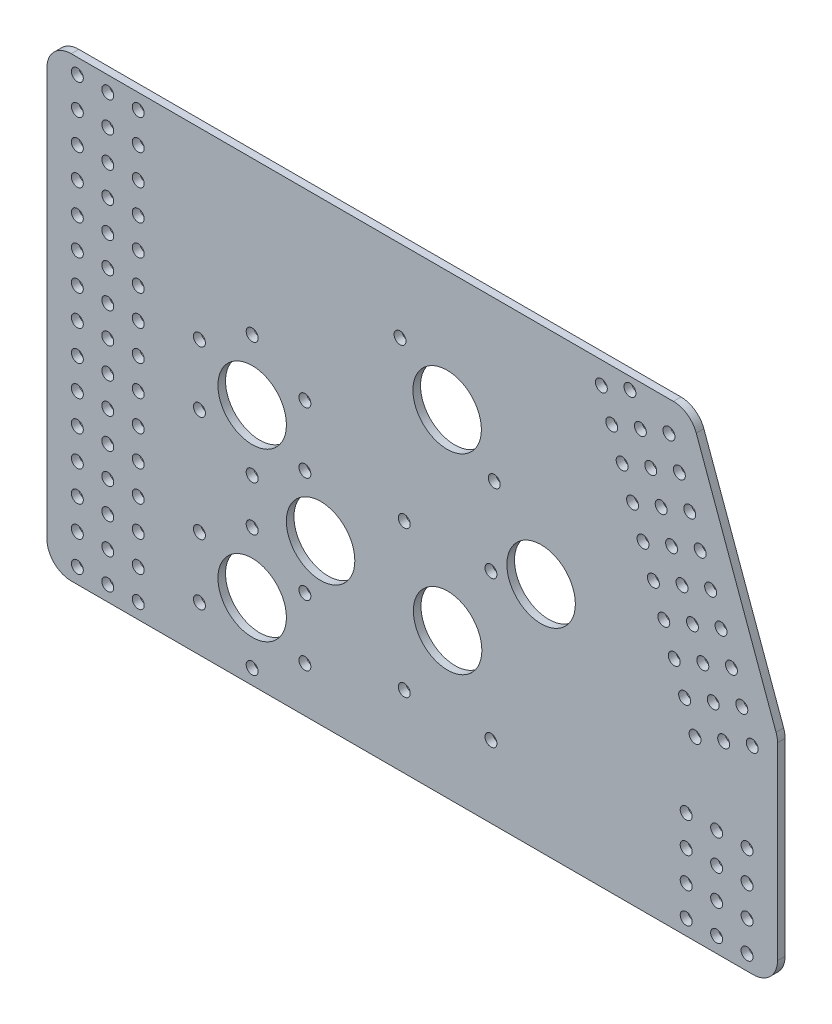
from build123d import *

# Parameters (mm, degrees)
SKETCH6_R           = 2.4892
SKETCH6_R_2         = 14.2875
BOSS_EXTRUDE1_DEPTH = 3.175
FILLET1_R           = 10.16


with BuildPart() as part:
    # Sketch6 → Boss-Extrude1 (new body)
    with BuildSketch(Plane.XY):
        Polygon((-62.034734806, 275.060295422), (206.435304788, 275.060295422), (242.765265194, 175.244549557), (242.765265194, 84.560295422), (-62.034734806, 84.560295422), align=None)
        with Locations((123.22406409, 114.608841068)):
            Circle(SKETCH6_R, mode=Mode.SUBTRACT)
        with Locations((87.05446409, 114.608841068)):
            Circle(SKETCH6_R, mode=Mode.SUBTRACT)
        with Locations((-49.334734806, 268.710295422)):
            Circle(SKETCH6_R, mode=Mode.SUBTRACT)
        with Locations((-49.334734806, 90.910295422)):
            Circle(SKETCH6_R, mode=Mode.SUBTRACT)
        with Locations((-36.634734806, 268.710295422)):
            Circle(SKETCH6_R, mode=Mode.SUBTRACT)
        with Locations((-23.934734806, 268.710295422)):
            Circle(SKETCH6_R, mode=Mode.SUBTRACT)
        with Locations((-36.634734806, 256.010295422)):
            Circle(SKETCH6_R, mode=Mode.SUBTRACT)
        with Locations((-23.934734806, 256.010295422)):
            Circle(SKETCH6_R, mode=Mode.SUBTRACT)
        with Locations((-36.634734806, 243.310295422)):
            Circle(SKETCH6_R, mode=Mode.SUBTRACT)
        with Locations((-23.934734806, 243.310295422)):
            Circle(SKETCH6_R, mode=Mode.SUBTRACT)
        with Locations((-36.634734806, 230.610295422)):
            Circle(SKETCH6_R, mode=Mode.SUBTRACT)
        with Locations((-23.934734806, 230.610295422)):
            Circle(SKETCH6_R, mode=Mode.SUBTRACT)
        with Locations((-36.634734806, 217.910295422)):
            Circle(SKETCH6_R, mode=Mode.SUBTRACT)
        with Locations((-23.934734806, 217.910295422)):
            Circle(SKETCH6_R, mode=Mode.SUBTRACT)
        with Locations((-36.634734806, 205.210295422)):
            Circle(SKETCH6_R, mode=Mode.SUBTRACT)
        with Locations((-23.934734806, 205.210295422)):
            Circle(SKETCH6_R, mode=Mode.SUBTRACT)
        with Locations((-36.634734806, 192.510295422)):
            Circle(SKETCH6_R, mode=Mode.SUBTRACT)
        with Locations((-23.934734806, 192.510295422)):
            Circle(SKETCH6_R, mode=Mode.SUBTRACT)
        with Locations((-36.634734806, 179.810295422)):
            Circle(SKETCH6_R, mode=Mode.SUBTRACT)
        with Locations((-23.934734806, 179.810295422)):
            Circle(SKETCH6_R, mode=Mode.SUBTRACT)
        with Locations((-36.634734806, 167.110295422)):
            Circle(SKETCH6_R, mode=Mode.SUBTRACT)
        with Locations((-23.934734806, 167.110295422)):
            Circle(SKETCH6_R, mode=Mode.SUBTRACT)
        with Locations((-36.634734806, 154.410295422)):
            Circle(SKETCH6_R, mode=Mode.SUBTRACT)
        with Locations((-23.934734806, 154.410295422)):
            Circle(SKETCH6_R, mode=Mode.SUBTRACT)
        with Locations((-36.634734806, 141.710295422)):
            Circle(SKETCH6_R, mode=Mode.SUBTRACT)
        with Locations((-23.934734806, 141.710295422)):
            Circle(SKETCH6_R, mode=Mode.SUBTRACT)
        with Locations((-36.634734806, 129.010295422)):
            Circle(SKETCH6_R, mode=Mode.SUBTRACT)
        with Locations((-23.934734806, 129.010295422)):
            Circle(SKETCH6_R, mode=Mode.SUBTRACT)
        with Locations((-36.634734806, 116.310295422)):
            Circle(SKETCH6_R, mode=Mode.SUBTRACT)
        with Locations((-23.934734806, 116.310295422)):
            Circle(SKETCH6_R, mode=Mode.SUBTRACT)
        with Locations((-36.634734806, 103.610295422)):
            Circle(SKETCH6_R, mode=Mode.SUBTRACT)
        with Locations((-23.934734806, 103.610295422)):
            Circle(SKETCH6_R, mode=Mode.SUBTRACT)
        with Locations((-36.634734806, 90.910295422)):
            Circle(SKETCH6_R, mode=Mode.SUBTRACT)
        with Locations((-23.934734806, 90.910295422)):
            Circle(SKETCH6_R, mode=Mode.SUBTRACT)
        with Locations((-49.334734806, 256.010295422)):
            Circle(SKETCH6_R, mode=Mode.SUBTRACT)
        with Locations((-49.334734806, 243.310295422)):
            Circle(SKETCH6_R, mode=Mode.SUBTRACT)
        with Locations((-49.334734806, 230.610295422)):
            Circle(SKETCH6_R, mode=Mode.SUBTRACT)
        with Locations((-49.334734806, 217.910295422)):
            Circle(SKETCH6_R, mode=Mode.SUBTRACT)
        with Locations((-49.334734806, 205.210295422)):
            Circle(SKETCH6_R, mode=Mode.SUBTRACT)
        with Locations((-49.334734806, 192.510295422)):
            Circle(SKETCH6_R, mode=Mode.SUBTRACT)
        with Locations((-49.334734806, 179.810295422)):
            Circle(SKETCH6_R, mode=Mode.SUBTRACT)
        with Locations((-49.334734806, 167.110295422)):
            Circle(SKETCH6_R, mode=Mode.SUBTRACT)
        with Locations((-49.334734806, 154.410295422)):
            Circle(SKETCH6_R, mode=Mode.SUBTRACT)
        with Locations((-49.334734806, 141.710295422)):
            Circle(SKETCH6_R, mode=Mode.SUBTRACT)
        with Locations((-49.334734806, 129.010295422)):
            Circle(SKETCH6_R, mode=Mode.SUBTRACT)
        with Locations((-49.334734806, 116.310295422)):
            Circle(SKETCH6_R, mode=Mode.SUBTRACT)
        with Locations((-49.334734806, 103.610295422)):
            Circle(SKETCH6_R, mode=Mode.SUBTRACT)
        with Locations((169.26865969, 265.77786594)):
            Circle(SKETCH6_R, mode=Mode.SUBTRACT)
        with Locations((181.202755974, 270.121521761)):
            Circle(SKETCH6_R, mode=Mode.SUBTRACT)
        with Locations((197.480508078, 262.531081297)):
            Circle(SKETCH6_R, mode=Mode.SUBTRACT)
        with Locations((173.61231551, 253.843769656)):
            Circle(SKETCH6_R, mode=Mode.SUBTRACT)
        with Locations((185.546411794, 258.187425477)):
            Circle(SKETCH6_R, mode=Mode.SUBTRACT)
        with Locations((201.824163899, 250.596985013)):
            Circle(SKETCH6_R, mode=Mode.SUBTRACT)
        with Locations((177.955971331, 241.909673372)):
            Circle(SKETCH6_R, mode=Mode.SUBTRACT)
        with Locations((189.890067615, 246.253329193)):
            Circle(SKETCH6_R, mode=Mode.SUBTRACT)
        with Locations((206.167819719, 238.662888729)):
            Circle(SKETCH6_R, mode=Mode.SUBTRACT)
        with Locations((182.299627151, 229.975577088)):
            Circle(SKETCH6_R, mode=Mode.SUBTRACT)
        with Locations((194.233723435, 234.319232909)):
            Circle(SKETCH6_R, mode=Mode.SUBTRACT)
        with Locations((210.511475539, 226.728792445)):
            Circle(SKETCH6_R, mode=Mode.SUBTRACT)
        with Locations((186.643282971, 218.041480804)):
            Circle(SKETCH6_R, mode=Mode.SUBTRACT)
        with Locations((198.577379255, 222.385136625)):
            Circle(SKETCH6_R, mode=Mode.SUBTRACT)
        with Locations((214.855131359, 214.794696161)):
            Circle(SKETCH6_R, mode=Mode.SUBTRACT)
        with Locations((190.986938791, 206.10738452)):
            Circle(SKETCH6_R, mode=Mode.SUBTRACT)
        with Locations((202.921035075, 210.451040341)):
            Circle(SKETCH6_R, mode=Mode.SUBTRACT)
        with Locations((219.19878718, 202.860599877)):
            Circle(SKETCH6_R, mode=Mode.SUBTRACT)
        with Locations((195.330594612, 194.173288236)):
            Circle(SKETCH6_R, mode=Mode.SUBTRACT)
        with Locations((207.264690896, 198.516944057)):
            Circle(SKETCH6_R, mode=Mode.SUBTRACT)
        with Locations((223.542443, 190.926503593)):
            Circle(SKETCH6_R, mode=Mode.SUBTRACT)
        with Locations((199.674250432, 182.239191952)):
            Circle(SKETCH6_R, mode=Mode.SUBTRACT)
        with Locations((211.608346716, 186.582847773)):
            Circle(SKETCH6_R, mode=Mode.SUBTRACT)
        with Locations((227.88609882, 178.992407309)):
            Circle(SKETCH6_R, mode=Mode.SUBTRACT)
        with Locations((204.017906252, 170.305095668)):
            Circle(SKETCH6_R, mode=Mode.SUBTRACT)
        with Locations((215.952002536, 174.648751489)):
            Circle(SKETCH6_R, mode=Mode.SUBTRACT)
        with Locations((232.22975464, 167.058311025)):
            Circle(SKETCH6_R, mode=Mode.SUBTRACT)
        with Locations((208.361562072, 158.370999384)):
            Circle(SKETCH6_R, mode=Mode.SUBTRACT)
        with Locations((220.295658356, 162.714655205)):
            Circle(SKETCH6_R, mode=Mode.SUBTRACT)
        with Locations((204.665265194, 129.010295422)):
            Circle(SKETCH6_R, mode=Mode.SUBTRACT)
        with Locations((217.365265194, 129.010295422)):
            Circle(SKETCH6_R, mode=Mode.SUBTRACT)
        with Locations((230.065265194, 129.010295422)):
            Circle(SKETCH6_R, mode=Mode.SUBTRACT)
        with Locations((204.665265194, 116.310295422)):
            Circle(SKETCH6_R, mode=Mode.SUBTRACT)
        with Locations((217.365265194, 116.310295422)):
            Circle(SKETCH6_R, mode=Mode.SUBTRACT)
        with Locations((230.065265194, 116.310295422)):
            Circle(SKETCH6_R, mode=Mode.SUBTRACT)
        with Locations((204.665265194, 103.610295422)):
            Circle(SKETCH6_R, mode=Mode.SUBTRACT)
        with Locations((217.365265194, 103.610295422)):
            Circle(SKETCH6_R, mode=Mode.SUBTRACT)
        with Locations((230.065265194, 103.610295422)):
            Circle(SKETCH6_R, mode=Mode.SUBTRACT)
        with Locations((204.665265194, 90.910295422)):
            Circle(SKETCH6_R, mode=Mode.SUBTRACT)
        with Locations((217.365265194, 90.910295422)):
            Circle(SKETCH6_R, mode=Mode.SUBTRACT)
        with Locations((230.065265194, 90.910295422)):
            Circle(SKETCH6_R, mode=Mode.SUBTRACT)
        with Locations((23.601611853, 185.85256672)):
            Circle(SKETCH6_R_2, mode=Mode.SUBTRACT)
        with Locations((52.142163008, 151.05639055)):
            Circle(SKETCH6_R_2, mode=Mode.SUBTRACT)
        with Locations((23.601611853, 116.25656672)):
            Circle(SKETCH6_R_2, mode=Mode.SUBTRACT)
        with Locations((105.13926409, 145.139641068)):
            Circle(SKETCH6_R_2, mode=Mode.SUBTRACT)
        with Locations((104.944740556, 224.82726801)):
            Circle(SKETCH6_R_2, mode=Mode.SUBTRACT)
        with Locations((144.142354475, 181.392565924)):
            Circle(SKETCH6_R_2, mode=Mode.SUBTRACT)
        with Locations((85.284021432, 241.01081705)):
            Circle(SKETCH6_R, mode=Mode.SUBTRACT)
        with Locations((23.601611853, 141.65656672)):
            Circle(SKETCH6_R, mode=Mode.SUBTRACT)
        with Locations((45.598657109, 128.95656672)):
            Circle(SKETCH6_R, mode=Mode.SUBTRACT)
        with Locations((45.598657109, 103.55656672)):
            Circle(SKETCH6_R, mode=Mode.SUBTRACT)
        with Locations((23.601611853, 90.85656672)):
            Circle(SKETCH6_R, mode=Mode.SUBTRACT)
        with Locations((1.604566597, 103.55656672)):
            Circle(SKETCH6_R, mode=Mode.SUBTRACT)
        with Locations((1.604566597, 128.95656672)):
            Circle(SKETCH6_R, mode=Mode.SUBTRACT)
        with Locations((23.601611853, 211.25256672)):
            Circle(SKETCH6_R, mode=Mode.SUBTRACT)
        with Locations((45.598657109, 198.55256672)):
            Circle(SKETCH6_R, mode=Mode.SUBTRACT)
        with Locations((45.598657109, 173.15256672)):
            Circle(SKETCH6_R, mode=Mode.SUBTRACT)
        with Locations((23.601611853, 160.45256672)):
            Circle(SKETCH6_R, mode=Mode.SUBTRACT)
        with Locations((1.604566597, 173.15256672)):
            Circle(SKETCH6_R, mode=Mode.SUBTRACT)
        with Locations((1.604566597, 198.55256672)):
            Circle(SKETCH6_R, mode=Mode.SUBTRACT)
        with Locations((123.22406409, 175.670441068)):
            Circle(SKETCH6_R, mode=Mode.SUBTRACT)
        with Locations((87.05446409, 175.670441068)):
            Circle(SKETCH6_R, mode=Mode.SUBTRACT)
        with Locations((124.606520638, 208.84902209)):
            Circle(SKETCH6_R, mode=Mode.SUBTRACT)
    extrude(amount=BOSS_EXTRUDE1_DEPTH)

    # Fillet1
    fillet1_edges = [part.edges().sort_by_distance(p)[0] for p in [
        (242.765265194, 84.560295422, 1.5875),
        (242.765265194, 175.244549557, 1.5875),
        (206.435304788, 275.060295422, 1.5875),
        (-62.034734806, 84.560295422, 1.5875),
        (-62.034734806, 275.060295422, 1.5875),
    ]]
    fillet(fillet1_edges, radius=FILLET1_R)


solid = part.part
